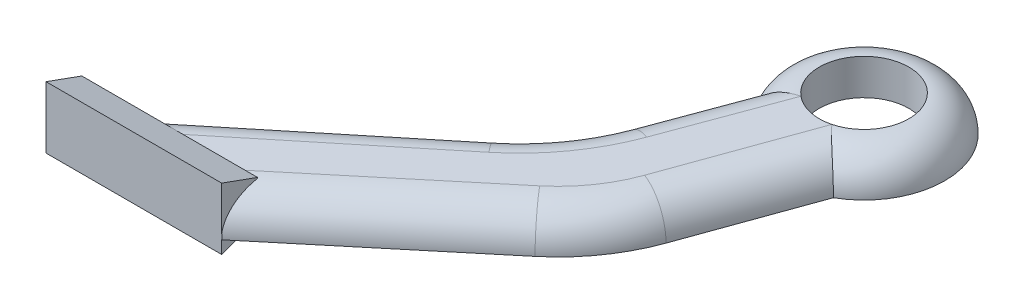
from build123d import *

# Parameters (mm, degrees)
SKETCH1_R                = 2.5000000000000004
BOSS_EXTRUDE1_DEPTH      = 2
FILLET1_R                = 10
FILLET2_R                = 10
FILLET5_R                = 2
FILLET6_R                = 2
BOSS_EXTRUDE2_DEPTH      = 5.3
BOSS_EXTRUDE2_DEPTH_BACK = 4.5


with BuildPart() as part:
    # Sketch1 → Boss-Extrude1 (new body)
    with BuildSketch(Plane(origin=(0, 0, 0), x_dir=(1, 0, 0), z_dir=(0, 1, 0))):
        with BuildLine():
            Line((4.734439187943633, 4.337505524576787), (-11.123424173439652, -8.60036927980545))
            Line((-11.123424173439652, -8.60036927980545), (-1.3192163601402593, -8.60036927980545))
            Line((-1.3192163601402593, -8.60036927980545), (10.29708605182919, 1.0617245936219641))
            Line((10.29708605182919, 1.0617245936219641), (13.693514413313048, 10.480195617492226))
            ThreePointArc((13.693514413313048, 10.480195617492226), (12.643820805599, 18.747230765158918), (7.611903426882685, 12.104525420451473))
            Line((7.611903426882685, 12.104525420451473), (4.734439187943633, 4.337505524576787))
        make_face()
        with Locations(Location((11.482625796556237, 14.39963072019455, 0), (0, 0, 270))):
            Circle(SKETCH1_R, mode=Mode.SUBTRACT)
    extrude(amount=BOSS_EXTRUDE1_DEPTH)

    # Fillet1
    fillet1_edges = [part.edges().sort_by_distance(p)[0] for p in [
        (10.29708605182919, 1, -1.0617245936219641),
    ]]
    fillet(fillet1_edges, radius=FILLET1_R)

    # Fillet2
    fillet2_edges = [part.edges().sort_by_distance(p)[0] for p in [
        (4.734439187943633, 1, -4.337505524576787),
    ]]
    fillet(fillet2_edges, radius=FILLET2_R)

    # Fillet5
    fillet5_edges = [part.edges().sort_by_distance(p)[0] for p in [
        (6.6461096923169105, 2, -9.49759844281185),
        (4.438286722207531, 2, -4.549211293465088),
        (12.456410034317898, 2, -7.049641368446211),
        (9.999920903343424, 2, -1.270100820961935),
        (-4.249333346620522, 2, 2.9920395518602865),
        (3.4439024153195033, 2, 4.638549149214148),
    ]]
    fillet(fillet5_edges, radius=FILLET5_R - 0.0001)  # a hair under: the kernel refuses the full size

    # Fillet6
    fillet6_edges = [part.edges().sort_by_distance(p)[0] for p in [
        (12.744313913733471, 2, -18.719137994754206),
    ]]
    fillet(fillet6_edges, radius=FILLET6_R - 0.0001)  # a hair under: the kernel refuses the full size

    # Sketch6 → Boss-Extrude2 (add, two sides: drawn at the far end of the back side and taken through both)
    with BuildSketch(Plane(origin=(-6.6499999999999995, 0, 0), x_dir=(0, 0, -1), z_dir=(1, 0, 0)).offset(-BOSS_EXTRUDE2_DEPTH_BACK)):
        Polygon((-8.60036927980545, 2.7250000000000005), (-6.60036927980545, 2), (-6.60036927980545, 0), (-8.60036927980545, -0.7249999999999998), align=None)
    extrude(amount=BOSS_EXTRUDE2_DEPTH + BOSS_EXTRUDE2_DEPTH_BACK)


solid = part.part
